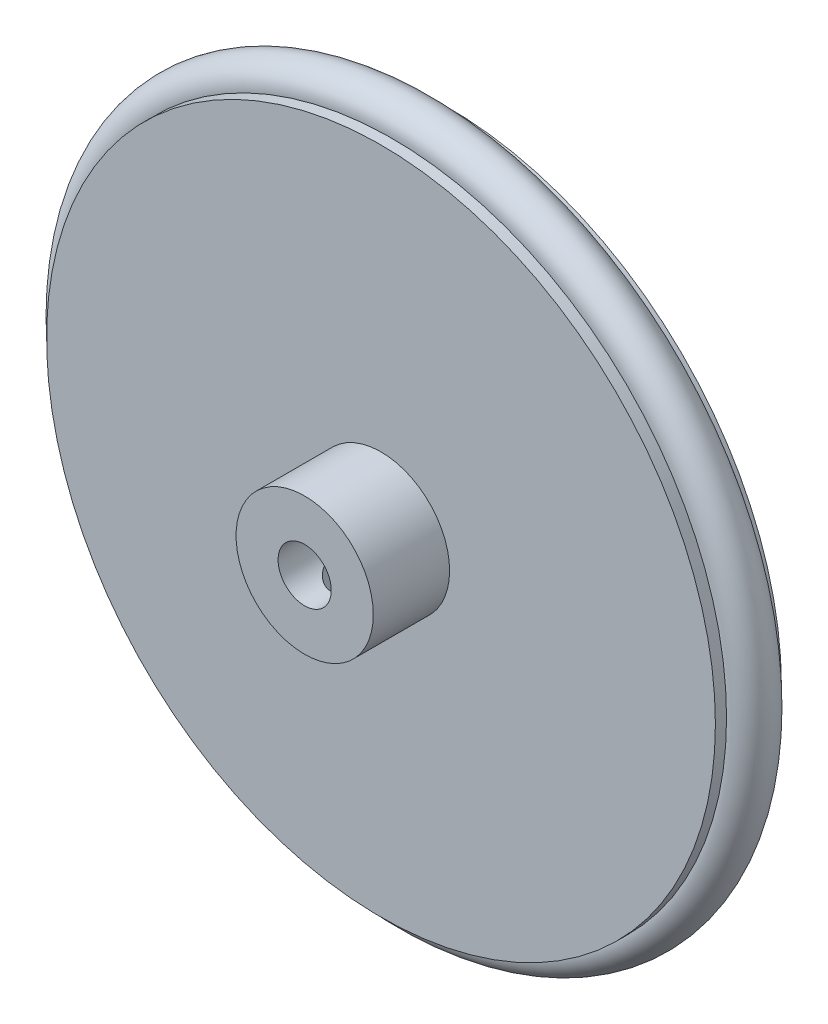
from build123d import *

# Parameters (mm, degrees)
SKETCH1_R           = 39
BOSS_EXTRUDE1_DEPTH = 3.85
SKETCH2_R           = 2.55
SWEEP1_OUTLINE_R    = 2.561236926
SKETCH4_R           = 8
BOSS_EXTRUDE2_DEPTH = 8.9
SKETCH5_R           = 3.1
CUT_EXTRUDE1_DEPTH  = 15.6
SKETCH6_R           = 2.25
CUT_EXTRUDE2_DEPTH  = 61.550547037


# Read off the part's stored shape, not the designer's step: Sweep1
with BuildPart() as part:
    # Sketch1 → Boss-Extrude1 (new, symmetric)
    with BuildSketch(Plane.XY):
        with Locations(Location((0, 0, 0), (0, 0, 180))):
            Circle(SKETCH1_R)
    extrude(amount=BOSS_EXTRUDE1_DEPTH, both=True)

    # Cut-Sweep1: sweep along a curve in space
    with BuildLine() as cut_sweep1_path:
        ThreePointArc((39, 0, -3.85), (27.577164466, 27.577164466, -3.85), (0, 39, -3.85))
        ThreePointArc((0, 39, -3.85), (-27.577164466, 27.577164466, -3.85), (-39, 0, -3.85))
        ThreePointArc((-39, 0, -3.85), (-27.577164466, -27.577164466, -3.85), (0, -39, -3.85))
        ThreePointArc((0, -39, -3.85), (27.577164466, -27.577164466, -3.85), (39, 0, -3.85))
    # Sketch2 → Cut-Sweep1 (sweep, cut)
    with BuildSketch(Plane(origin=(0, 0, 0), x_dir=(1, 0, 0), z_dir=(0, 1, 0))):
        with Locations((39, 0)):
            Circle(SKETCH2_R)
    sweep(path=cut_sweep1_path.line, mode=Mode.SUBTRACT)

    # Sketch4 → Boss-Extrude2 (add)
    with BuildSketch(Plane.XY.offset(3.85)):
        Circle(SKETCH4_R)
    extrude(amount=BOSS_EXTRUDE2_DEPTH)

    # Sketch5 → Cut-Extrude1 (cut)
    with BuildSketch(Plane.XY.offset(12.75)):
        Circle(SKETCH5_R)
    extrude(amount=-CUT_EXTRUDE1_DEPTH, mode=Mode.SUBTRACT)

    # Sketch6 → Cut-Extrude2 (cut, through all)
    with BuildSketch(Plane(origin=(0, 0, 0), x_dir=(1, 0, 0), z_dir=(0, 1, 0))):
        with Locations(Location((0, -7.5, 0), (0, 0, 270))):
            Circle(SKETCH6_R)
    extrude(amount=-CUT_EXTRUDE2_DEPTH, mode=Mode.SUBTRACT)


with BuildPart() as body_2:
    # Sweep1 outline → Sweep1 (revolve)
    with BuildSketch(Plane.XZ):
        with Locations((39.294504793, 0)):
            Circle(SWEEP1_OUTLINE_R)
    revolve(axis=Axis((0, 0, 0), (0, 0, 1)))


solid = Compound([part.part, body_2.part])
